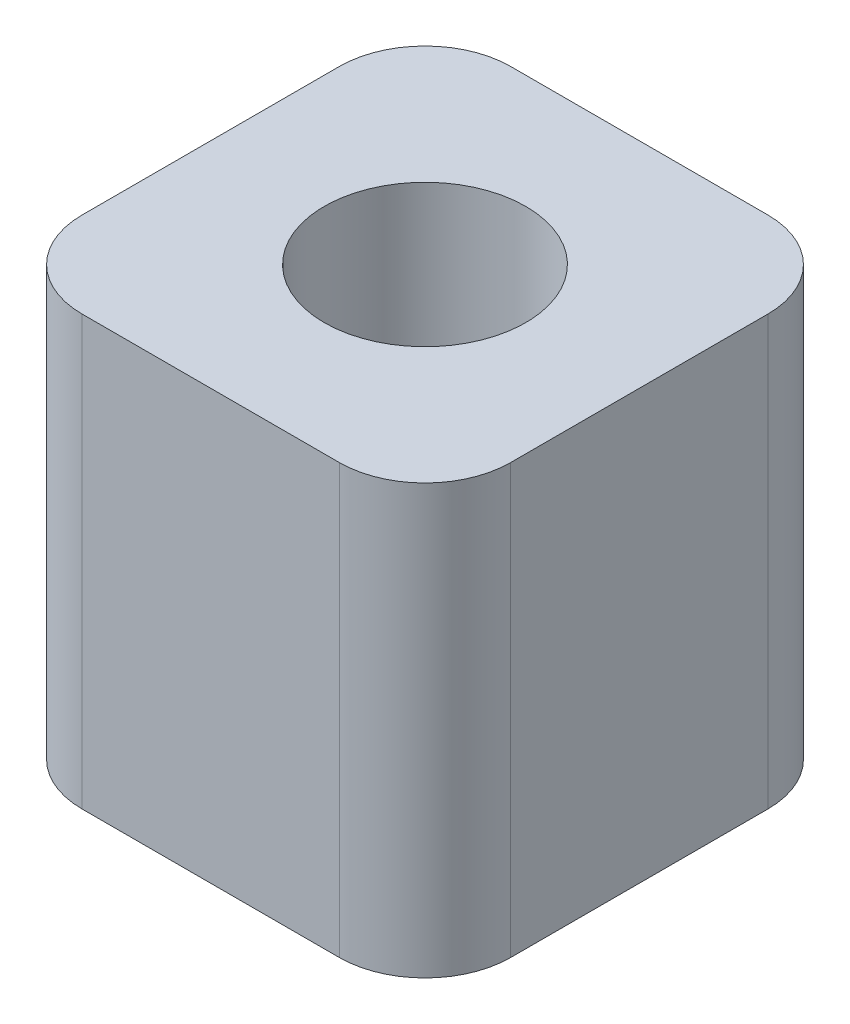
from build123d import *

# Parameters (mm, degrees)
SKETCH1_W           = 10
SKETCH1_H           = 10
SKETCH1_R           = 2.35
BOSS_EXTRUDE1_DEPTH = 10
FILLET1_R           = 2


with BuildPart() as part:
    # Sketch1 → Boss-Extrude1 (new body)
    with BuildSketch(Plane(origin=(0, 0, 0), x_dir=(1, 0, 0), z_dir=(0, 1, 0))):
        Rectangle(SKETCH1_W, SKETCH1_H)
        Circle(SKETCH1_R, mode=Mode.SUBTRACT)
    extrude(amount=BOSS_EXTRUDE1_DEPTH)

    # Fillet1
    fillet1_edges = [part.edges().sort_by_distance(p)[0] for p in [
        (-5, 5, 5),
        (-5, 5, -5),
        (5, 5, -5),
        (5, 5, 5),
    ]]
    fillet(fillet1_edges, radius=FILLET1_R)


solid = part.part
